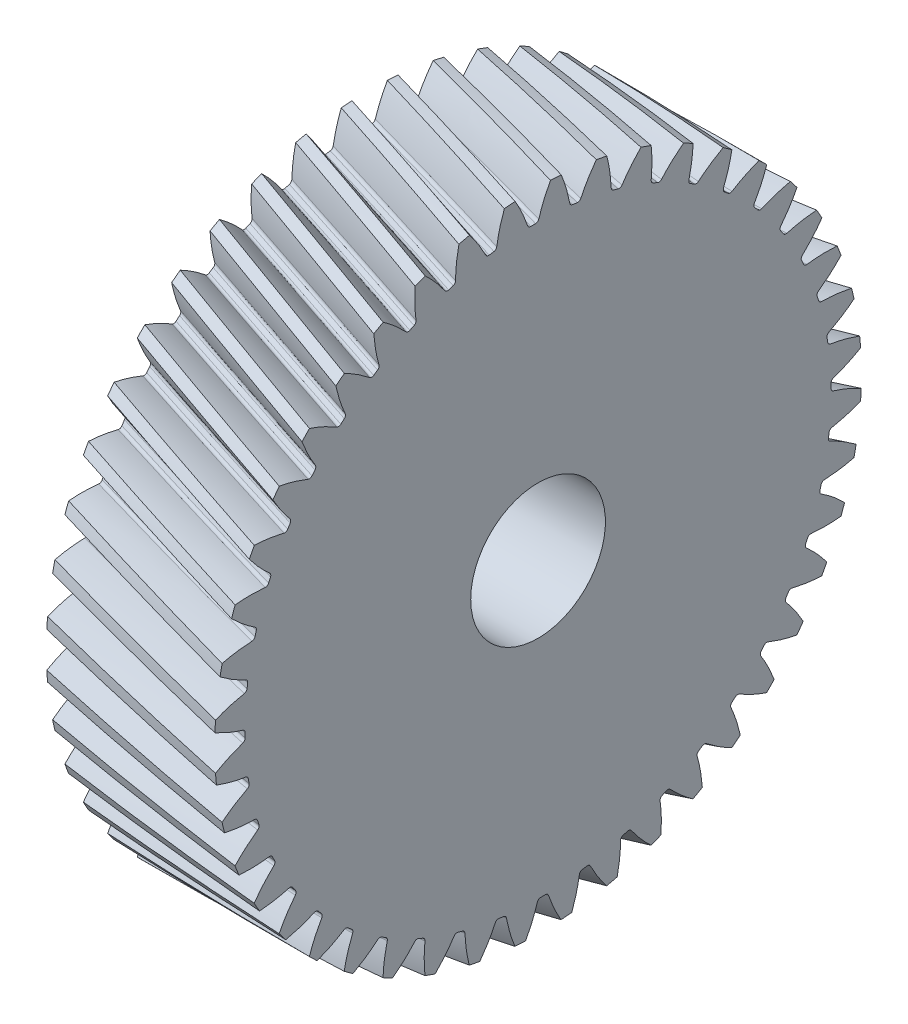
from build123d import *

# Parameters (mm, degrees)
BASPROSKE_W            = 10
BASPROSKE_H            = 19.204174914
TOOTHCUTRH_PITCH       = 394.672164016
TOOTHCUTRH_HEIGHT      = 10
TOOTHCUTRH_RADIUS      = 19.204174914
TOOTHCUTRH_START_ANGLE = -90
TEETHCUTSRH_COUNT      = 44
TEETHCUTSRH_ANGLE      = 351.818181818
BORSKE_R               = 4
BORE_DEPTH             = 62.5000025


with BuildPart() as part:
    # BasProSke → Base-Revolve (revolve)
    with BuildSketch(Plane(origin=(0, 0, 0), x_dir=(1, 0, 0), z_dir=(0, 1, 0)), mode=Mode.PRIVATE) as base_revolve_sk:
        with Locations((5, 9.602087457)):
            Rectangle(BASPROSKE_W, BASPROSKE_H)
    revolve(base_revolve_sk.sketch.rotate(Axis((-10, 0, 0), (1, 0, 0)), 180), axis=Axis((-10, 0, 0), (1, 0, 0)))

    # ToothCutRH: sweep along a helix
    with BuildLine() as toothcutrh_path:
        add(Helix(TOOTHCUTRH_PITCH, TOOTHCUTRH_HEIGHT, TOOTHCUTRH_RADIUS, center=(0, 0, 0), direction=(1, 0, 0), mode=Mode.PRIVATE).rotate(Axis((0, 0, 0), (1, 0, 0)), TOOTHCUTRH_START_ANGLE))
    # TooCutSkeRH → ToothCutRH (sweep, cut)
    with BuildSketch(Plane(origin=(0, 0, 0), x_dir=(0, 0, -1), z_dir=(1, 0, 0))):
        with BuildLine():
            ThreePointArc((0.139689491, 17.403614317), (0, 17.404174914), (-0.139689491, 17.403614317))
            ThreePointArc((-0.139689491, 17.403614317), (-0.258904759, 17.441602415), (-0.332549286, 17.542755069))
            ThreePointArc((-0.332549286, 17.542755069), (-0.787071802, 18.673782504), (-1.393522994, 19.731152226))
            ThreePointArc((-1.393522994, 19.731152226), (0, 19.780300162), (1.393522994, 19.731152226))
            ThreePointArc((1.393522994, 19.731152226), (0.787071802, 18.673782504), (0.332549286, 17.542755069))
            ThreePointArc((0.332549286, 17.542755069), (0.258904759, 17.441602415), (0.139689491, 17.403614317))
        make_face()
    toothcutrh = sweep(path=toothcutrh_path.line, is_frenet=True, mode=Mode.SUBTRACT)

    # TeethCutsRH: ToothCutRH ×44 about axis
    teethcutsrh_axis = Axis((-10, 0, 0), (1, 0, 0))
    for i in range(1, TEETHCUTSRH_COUNT):
        add(toothcutrh.rotate(teethcutsrh_axis, i * TEETHCUTSRH_ANGLE / (TEETHCUTSRH_COUNT - 1)), mode=Mode.SUBTRACT)

    # BorSke → Bore (cut, symmetric)
    with BuildSketch(Plane(origin=(0, 0, 0), x_dir=(0, 0, -1), z_dir=(1, 0, 0))):
        with Locations(Location((0, 0, 0), (0, 0, 180))):
            Circle(BORSKE_R)
    extrude(amount=BORE_DEPTH, both=True, mode=Mode.SUBTRACT)


solid = part.part
